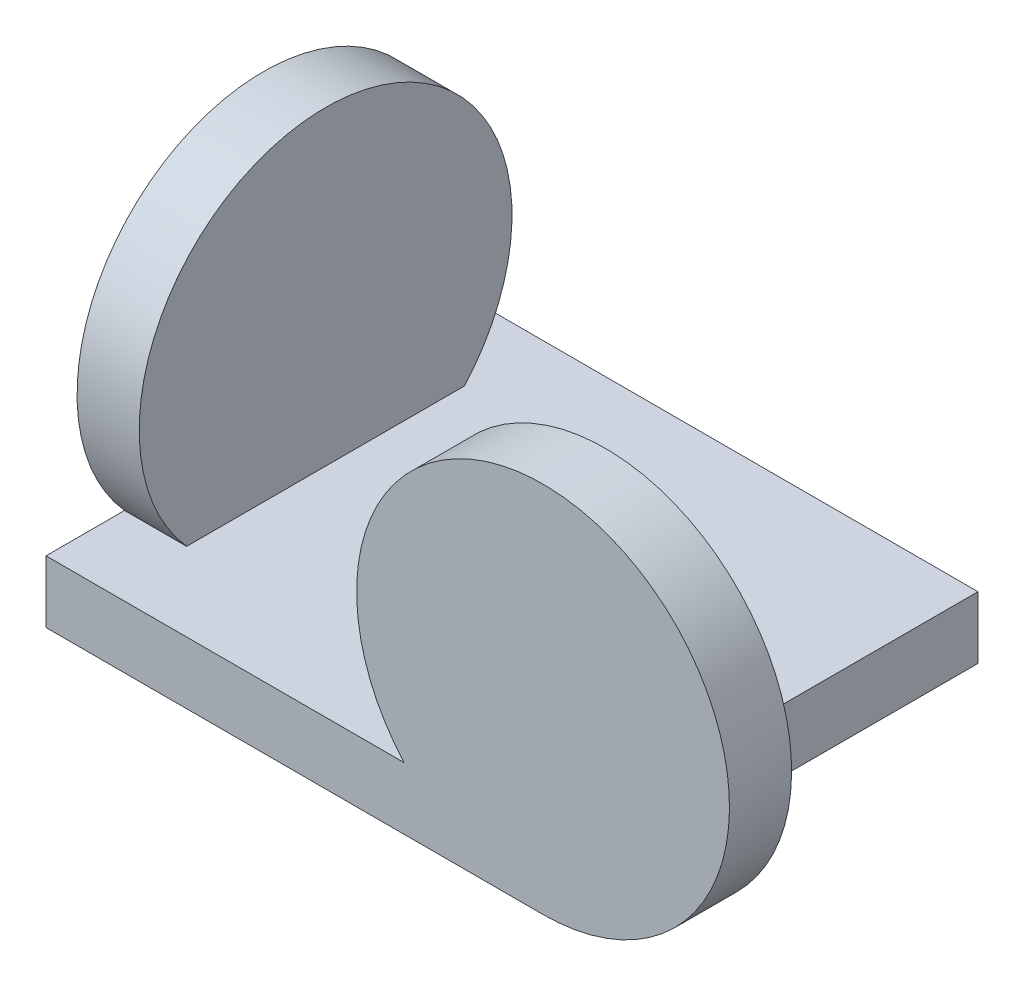
from build123d import *

# Parameters (mm, degrees)
SKETCH1_R           = 30
BOSS_EXTRUDE1_DEPTH = 10
SKETCH2_W           = 80
SKETCH2_H           = 10
BOSS_EXTRUDE2_DEPTH = 70
SKETCH3_R           = 30
BOSS_EXTRUDE3_DEPTH = 10


with BuildPart() as part:
    # Sketch1 → Boss-Extrude1 (new body)
    with BuildSketch(Plane.XY):
        Circle(SKETCH1_R)
    extrude(amount=BOSS_EXTRUDE1_DEPTH)

    # Sketch2 → Boss-Extrude2 (add)
    with BuildSketch(Plane.XY.offset(10)):
        with Locations((-40, -25)):
            Rectangle(SKETCH2_W, SKETCH2_H)
    extrude(amount=-BOSS_EXTRUDE2_DEPTH)

    # Sketch3 → Boss-Extrude3 (add)
    with BuildSketch(Plane.ZY.offset(80)):
        with Locations((-25, 0)):
            Circle(SKETCH3_R)
    extrude(amount=-BOSS_EXTRUDE3_DEPTH)


solid = part.part
